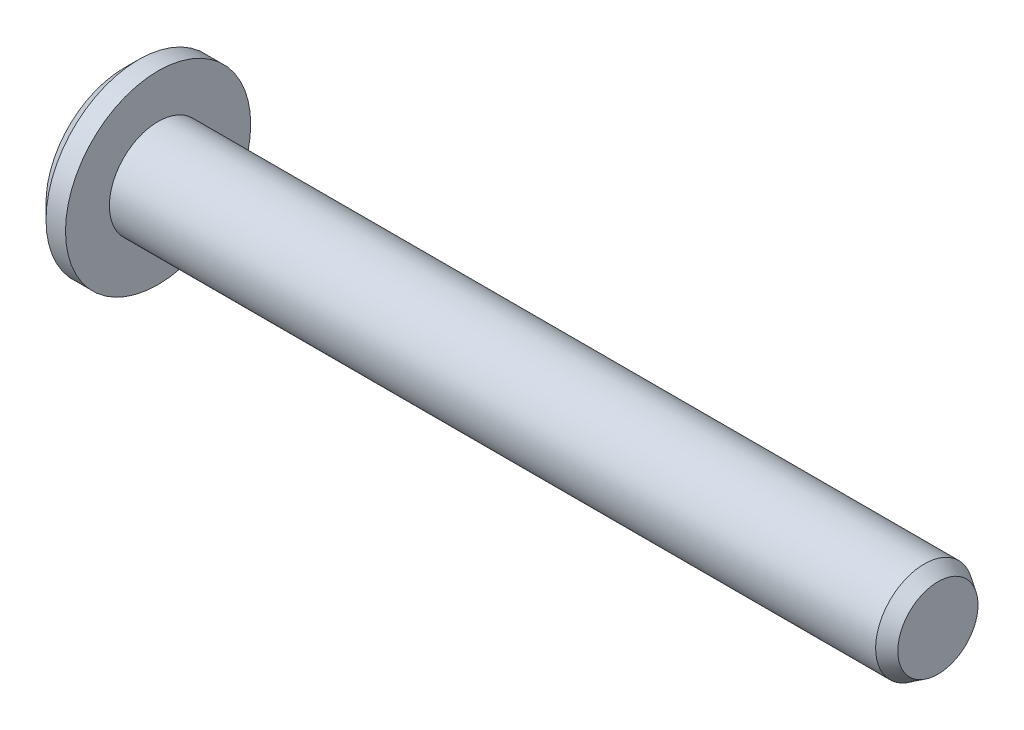
from build123d import *

# Parameters (mm, degrees)
CUT_EXTRUDE1_DEPTH = 1
CHAMFER1_SIZE      = 0.75


with BuildPart() as part:
    # Sketch1 → Revolve1 (revolve)
    with BuildSketch(Plane.XY):
        Polygon((41.75, 0), (41.75, 2.057236169), (41.055, 2.5), (1.75, 2.5), (1.75, 4.75), (0, 4.75), (0, 0), align=None)
    revolve(axis=Axis((0, 0, 0), (1, 0, 0)))

    # Sketch5 → Cut-Extrude1 (cut)
    with BuildSketch(Plane.ZY):
        Polygon((1.5, -0.866025404), (1.5, 0.866025404), (0, 1.732050808), (-1.5, 0.866025404), (-1.5, -0.866025404), (0, -1.732050808), align=None)
    extrude(amount=-CUT_EXTRUDE1_DEPTH, mode=Mode.SUBTRACT)

    # Chamfer1
    chamfer1_edges = [part.edges().sort_by_distance(p)[0] for p in [
        (0, -4.75, 0),
    ]]
    chamfer(chamfer1_edges, length=CHAMFER1_SIZE)


solid = part.part
